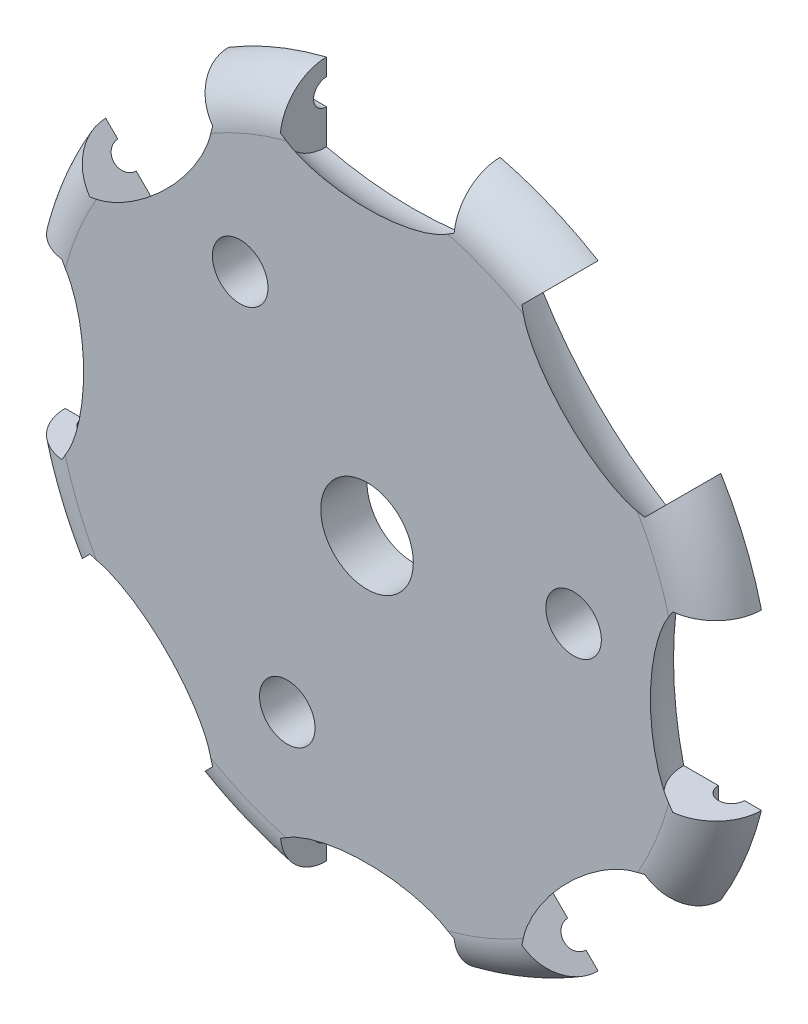
from build123d import *

# Parameters (mm, degrees)
SKETCH1_R           = 24.60625
BOSS_EXTRUDE1_DEPTH = 3.175
FILLET1_R           = 3.18516
SKETCH2_R           = 1.905
SKETCH2_R_2         = 3.175
CUT_EXTRUDE1_DEPTH  = 35.943012295
SKETCH6_R           = 0.889
CUT_EXTRUDE2_DEPTH  = 7.9375
CIRPATTERN1_COUNT   = 8


with BuildPart() as part:
    # Sketch1 → Boss-Extrude1 (new body)
    with BuildSketch(Plane.XY):
        Circle(SKETCH1_R)
    extrude(amount=BOSS_EXTRUDE1_DEPTH)

    # Fillet1
    # the kernel refuses this fillet: 3.18516 mm, written as the material it takes off along each edge
    with BuildSketch(Plane(origin=(0, 0, 3.175), x_dir=(1, 0, 0), z_dir=(0, -1, 0))) as fillet1_piece_1:
        with BuildLine():
            CenterArc((24.60625 - FILLET1_R, -FILLET1_R), FILLET1_R, 0, 90)
            Line((24.60625 - FILLET1_R, 0), (24.60625, 0))
            Line((24.60625, 0), (24.60625, -FILLET1_R))
        make_face()
    revolve(axis=Axis((0, 0, 3.175), (0, 0, 1)), mode=Mode.SUBTRACT)

    # Sketch2 → Cut-Extrude1 (cut, through all)
    with BuildSketch(Plane.XY.offset(3.175)):
        with Locations((-5.46758954, -13.199928821)):
            Circle(SKETCH2_R)
        with Locations((-8.697678917, 11.335035849)):
            Circle(SKETCH2_R)
        with Locations((14.165268457, 1.864892971)):
            Circle(SKETCH2_R)
        Circle(SKETCH2_R_2)
    extrude(amount=-CUT_EXTRUDE1_DEPTH, mode=Mode.SUBTRACT)

    # Sketch5 → Cut-Revolve1 (revolve, cut)
    with BuildSketch(Plane.XY):
        with BuildLine():
            Line((-5.953125, 21.81225), (5.953125, 21.81225))
            Line((5.953125, 21.81225), (5.953125, 25.084263269))
            ThreePointArc((5.953125, 25.084263269), (0, 25.781), (-5.953125, 25.084263269))
            Line((-5.953125, 25.084263269), (-5.953125, 21.81225))
        make_face()
    cut_revolve1 = revolve(axis=Axis((-5.953125, 21.81225, 0), (-1, 0, 0)), mode=Mode.SUBTRACT)

    # Sketch6 → Cut-Extrude2 (cut, symmetric)
    with BuildSketch(Plane(origin=(0, 0, 0), x_dir=(0, 0, -1), z_dir=(1, 0, 0))):
        with Locations((0, 21.81225)):
            Circle(SKETCH6_R)
    cut_extrude2 = extrude(amount=CUT_EXTRUDE2_DEPTH, both=True, mode=Mode.SUBTRACT)

    # CirPattern1: Cut-Revolve1, Cut-Extrude2 ×8 about axis
    cirpattern1_axis = Axis((0, 0, 0), (0, 0, 1))
    add([cut_revolve1.rotate(cirpattern1_axis, i * 360 / CIRPATTERN1_COUNT) for i in range(1, CIRPATTERN1_COUNT)], mode=Mode.SUBTRACT)
    add([cut_extrude2.rotate(cirpattern1_axis, i * 360 / CIRPATTERN1_COUNT) for i in range(1, CIRPATTERN1_COUNT)], mode=Mode.SUBTRACT)


solid = part.part
